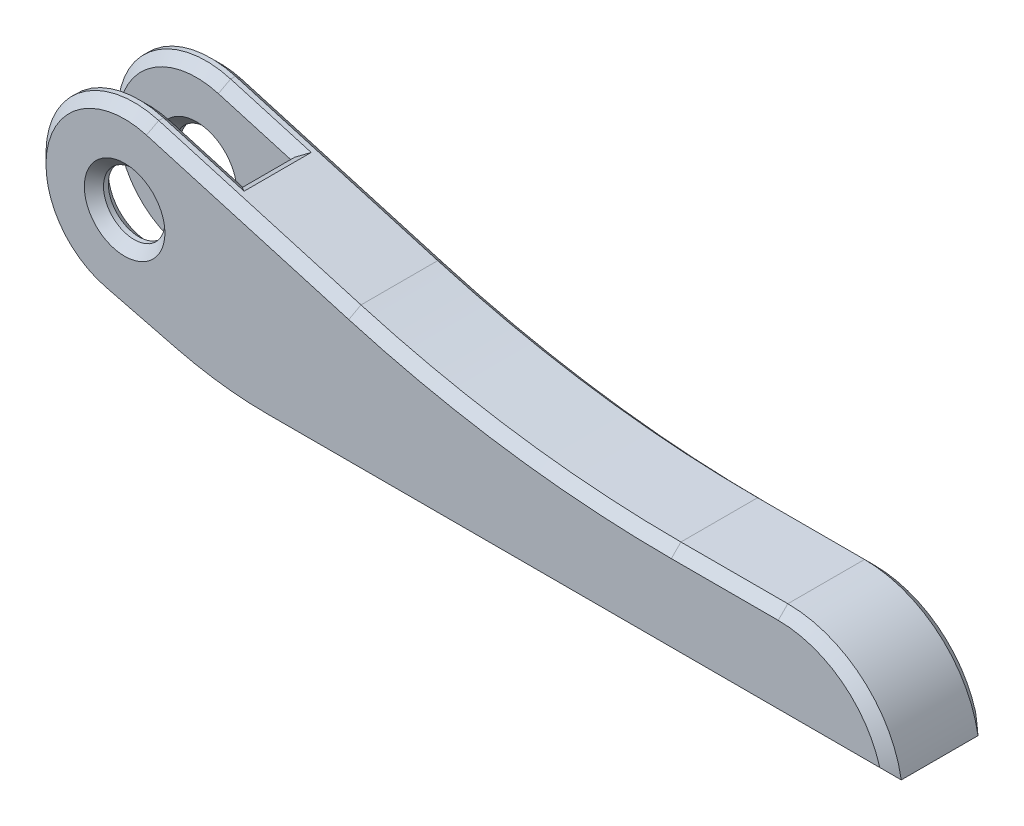
from build123d import *

# Parameters (mm, degrees)
SKETCH1_W           = 44.45
SKETCH1_H           = 6.35
BOSS_EXTRUDE1_DEPTH = 6.35
SKETCH2_R           = 5.842
SKETCH2_R_2         = 2.032
BOSS_EXTRUDE2_DEPTH = 6.35
SKETCH4_W           = 12.192
SKETCH4_H           = 3.175
CUT_EXTRUDE2_DEPTH  = 38.092262778
FILLET1_R           = 76.2
FILLET2_R           = 25.4
FILLET3_R           = 7.62
SKETCH1_3_R         = 2.032
CUT_EXTRUDE1_DEPTH  = 5.08
CHAMFER2_SIZE       = 0.635
CHAMFER2_SIZE_2     = 0.512675012
CHAMFER2_SIZE_3     = 0.731105081


with BuildPart() as part:
    # Sketch1 → Boss-Extrude1 (new body)
    with BuildSketch(Plane(origin=(0, 0, 0), x_dir=(1, 0, 0), z_dir=(0, 1, 0))):
        Rectangle(SKETCH1_W, SKETCH1_H)
    extrude(amount=BOSS_EXTRUDE1_DEPTH)

    # Sketch2 → Boss-Extrude2 (add, through all)
    # profile 1 of 2: a face of its own
    with BuildSketch(Plane.XY.offset(3.175)):
        with BuildLine():
            Line((-3.175, 6.35), (-26.950756689, 13.231666211))
            ThreePointArc((-26.950756689, 13.231666211), (-23.905000352, 11.12999534), (-22.733, 7.62))
            ThreePointArc((-22.733, 7.62), (-24.982746663, 3.012974934), (-29.999237577, 1.954268686))
            Line((-29.999237577, 1.954268686), (-22.225, 0))
            Line((-22.225, 0), (-22.225, 6.35))
            Line((-22.225, 6.35), (-3.175, 6.35))
        make_face()
    # profile 2 of 2: a face of its own
    with BuildSketch(Plane.XY.offset(3.175)):
        with Locations((-28.575, 7.62)):
            Circle(SKETCH2_R)
        with Locations((-28.575, 7.62)):
            Circle(SKETCH2_R_2, mode=Mode.SUBTRACT)
    extrude(amount=-BOSS_EXTRUDE2_DEPTH)

    # Sketch4 → Cut-Extrude2 (cut, through all)
    with BuildSketch(Plane.XZ):
        with Locations((-28.321, 0)):
            Rectangle(SKETCH4_W, SKETCH4_H)
    extrude(amount=-CUT_EXTRUDE2_DEPTH, mode=Mode.SUBTRACT)

    # Fillet1
    fillet1_edges = [part.edges().sort_by_distance(p)[0] for p in [
        (-3.175, 6.35, 0),
    ]]
    fillet(fillet1_edges, radius=FILLET1_R)

    # Fillet2
    # the kernel refuses this fillet: 25.4 mm, written as the material it takes off along each edge
    with BuildSketch(Plane(origin=(-22.225, 0, 6.271484857), x_dir=(-0.9698273389527705, 0.2437928067433249, 0), z_dir=(0, 0, -1))) as fillet2_piece_1:
        with BuildLine():
            CenterArc((FILLET2_R * 0.123763541059, FILLET2_R), FILLET2_R, 255.889496413, 14.110503587)
            Line((-FILLET2_R * 0.120029265684, FILLET2_R * 0.0301726610472), (0, 0))
            Line((0, 0), (FILLET2_R * 0.123763541059, 0))
        make_face()
    extrude(amount=17.305469714, mode=Mode.SUBTRACT)
    with BuildSketch(Plane(origin=(-22.225, 0, 11.033984857), x_dir=(1, 0, 0), z_dir=(0, 0, -1))) as fillet2_piece_2:
        with BuildLine():
            CenterArc((FILLET2_R * 0.123763541059, -FILLET2_R), FILLET2_R, 90, 14.110503587)
            Line((-FILLET2_R * 0.120029265684, -FILLET2_R * 0.0301726610472), (0, 0))
            Line((0, 0), (FILLET2_R * 0.123763541059, 0))
        make_face()
    extrude(amount=17.305469714, mode=Mode.SUBTRACT)

    # Fillet3
    # the kernel refuses this fillet: 7.62 mm, written as the material it takes off along each edge
    with BuildSketch(Plane(origin=(22.225, 6.35, -21.958553311), x_dir=(0, -1, 0), z_dir=(0, 0, 1))) as fillet3_piece_1:
        with BuildLine():
            CenterArc((7.62, -7.513421325), FILLET3_R, 99.594068227, 80.405931773)
            Line((0, -7.513421325), (-0.1524, -7.513421325))
            Line((-0.1524, -7.513421325), (-0.1524, 0))
            Line((-0.1524, 0), (0, 0.1524))
            ThreePointArc((0, 0.1524), (3.175, 0.1524), (6.3246, 0.150268426))
            Line((6.3246, 0.150268426), (6.35, 0))
        make_face()
    extrude(amount=43.917106623, mode=Mode.SUBTRACT)

    # Sketch1<3> → Cut-Extrude1 (cut)
    with BuildSketch(Plane(origin=(0, 0, 0), x_dir=(1, 0, 0), z_dir=(0, 1, 0))):
        with Locations(Location((-15.875, 0, 0), (0, 0, 270))):
            Circle(SKETCH1_3_R)
        with Locations(Location((15.875, 0, 0), (0, 0, 270))):
            Circle(SKETCH1_3_R)
    extrude(amount=CUT_EXTRUDE1_DEPTH, mode=Mode.SUBTRACT)

    # Chamfer2
    # the kernel refuses this chamfer: 0.731105081, 0.635, 0.512675012 mm, written as the material it takes off along each edge
    with BuildSketch(Plane(origin=(-13.554867596, 9.354353764, 3.175), x_dir=(0, 0, -1), z_dir=(-0.9605727852432785, 0.27802863926216387, 0)), Plane(origin=(-13.554867596, 9.354353764, -3.175), x_dir=(-0.27802863926216387, -0.9605727852432785, 0), z_dir=(-0.9605727852432785, 0.27802863926216387, 0))) as chamfer2_piece_1:
        Polygon((CHAMFER2_SIZE, 0), (0, CHAMFER2_SIZE), (0, 0), align=None)
    extrude(amount=13.945730401, mode=Mode.SUBTRACT)
    with BuildSketch(Plane(origin=(-29.999237577, 1.954268686, -3.175), x_dir=(0.2437928067433245, 0.9698273389527705, 0), z_dir=(0.9698273389527705, -0.24379280674332449, 0))) as chamfer2_piece_2:
        Polygon((CHAMFER2_SIZE, 0), (0, CHAMFER2_SIZE), (0, 0), align=None)
    extrude(amount=4.872510847, mode=Mode.SUBTRACT)
    with BuildSketch(Plane(origin=(-28.575, 7.62, -3.175), x_dir=(0.2780286392621638, 0.9605727852432784, 0), z_dir=(0.9605727852432784, -0.2780286392621638, 0))) as chamfer2_piece_3:
        Polygon((5.842 - CHAMFER2_SIZE, 0), (5.842, CHAMFER2_SIZE), (5.842, 0), align=None)
    revolve(axis=Axis((-28.575, 7.62, -3.175), (0, 0, 1)), revolution_arc=182.032079325, mode=Mode.SUBTRACT)
    with BuildSketch(Plane(origin=(-28.575, 7.62, 3.175), x_dir=(1, 0, 0), z_dir=(0, -1, 0))) as chamfer2_piece_4:
        Polygon((2.032 + CHAMFER2_SIZE, 0), (2.032, -CHAMFER2_SIZE), (2.032, 0), align=None)
    revolve(axis=Axis((-28.575, 7.62, 3.175), (0, 0, 1)), mode=Mode.SUBTRACT)
    with BuildSketch(Plane(origin=(-28.575, 7.62, -3.175), x_dir=(1, 0, 0), z_dir=(0, -1, 0))) as chamfer2_piece_5:
        Polygon((2.032 + CHAMFER2_SIZE, 0), (2.032, CHAMFER2_SIZE), (2.032, 0), align=None)
    revolve(axis=Axis((-28.575, 7.62, -3.175), (0, 0, 1)), mode=Mode.SUBTRACT)
    with BuildSketch(Plane(origin=(-28.575, 7.62, 3.175), x_dir=(0.2780286392621638, 0.9605727852432784, 0), z_dir=(0.9605727852432784, -0.2780286392621638, 0))) as chamfer2_piece_6:
        Polygon((5.842 - CHAMFER2_SIZE, 0), (5.842, -CHAMFER2_SIZE), (5.842, 0), align=None)
    revolve(axis=Axis((-28.575, 7.62, 3.175), (0, 0, 1)), revolution_arc=182.032079325, mode=Mode.SUBTRACT)
    with BuildSketch(Plane(origin=(-29.999237577, 1.954268686, 3.175), x_dir=(0.24379280674332446, 0.9698273389527705, 0), z_dir=(0.9698273389527705, -0.24379280674332449, 0))) as chamfer2_piece_7:
        Polygon((CHAMFER2_SIZE, 0), (0, -CHAMFER2_SIZE), (0, 0), align=None)
    extrude(amount=4.872510847, mode=Mode.SUBTRACT)
    with BuildSketch(Plane(origin=(-28.575, 7.62, -1.5875), x_dir=(1, 0, 0), z_dir=(0, -1, 0))) as chamfer2_piece_8:
        Polygon((2.032, -CHAMFER2_SIZE), (2.032 + CHAMFER2_SIZE, 0), (2.032, 0), align=None)
    revolve(axis=Axis((-28.575, 7.62, -1.5875), (0, 0, 1)), mode=Mode.SUBTRACT)
    with BuildSketch(Plane(origin=(-28.575, 7.62, 1.5875), x_dir=(1, 0, 0), z_dir=(0, -1, 0))) as chamfer2_piece_9:
        Polygon((2.032 + CHAMFER2_SIZE, 0), (2.032, CHAMFER2_SIZE), (2.032, 0), align=None)
    revolve(axis=Axis((-28.575, 7.62, 1.5875), (0, 0, 1)), mode=Mode.SUBTRACT)
    with BuildSketch(Plane(origin=(7.630914716, 6.35, -3.175), x_dir=(0, -1, 0), z_dir=(1, 0, 0))) as chamfer2_piece_10:
        Polygon((CHAMFER2_SIZE, 0), (0, -CHAMFER2_SIZE), (0, 0), align=None)
    extrude(amount=7.08066396, mode=Mode.SUBTRACT)
    with BuildSketch(Plane(origin=(14.711578675, 6.35, 3.175), x_dir=(0, 0, -1), z_dir=(-1, 0, 0))) as chamfer2_piece_11:
        Polygon((CHAMFER2_SIZE, 0), (0, CHAMFER2_SIZE), (0, 0), align=None)
    extrude(amount=7.08066396, mode=Mode.SUBTRACT)
    with BuildSketch(Plane(origin=(7.630914716, 82.55, 3.175), x_dir=(0, -1, 0), z_dir=(1, 0, 0))) as chamfer2_piece_12:
        Polygon((76.2, CHAMFER2_SIZE), (76.2 + CHAMFER2_SIZE, 0), (76.2, 0), align=None)
    revolve(axis=Axis((7.630914716, 82.55, 3.175), (0, 0, -1)), revolution_arc=16.142582912, mode=Mode.SUBTRACT)
    with BuildSketch(Plane(origin=(7.630914716, 82.55, -3.175), x_dir=(0, -1, 0), z_dir=(1, 0, 0))) as chamfer2_piece_13:
        Polygon((76.2 + CHAMFER2_SIZE, 0), (76.2, -CHAMFER2_SIZE), (76.2, 0), align=None)
    revolve(axis=Axis((7.630914716, 82.55, -3.175), (0, 0, -1)), revolution_arc=16.142582912, mode=Mode.SUBTRACT)
    with BuildSketch(Plane(origin=(23.858018697, 0, 3.175), x_dir=(0, 0, -1), z_dir=(-1, 0, 0))) as chamfer2_piece_14:
        Polygon((CHAMFER2_SIZE, 0), (0, -CHAMFER2_SIZE), (0, 0), align=None)
    extrude(amount=42.939424754, mode=Mode.SUBTRACT)
    with BuildSketch(Plane(origin=(-19.081406057, 25.4, 3.175), x_dir=(-0.24379280674296488, -0.9698273389528609, 0), z_dir=(-0.9698273389528609, 0.24379280674296488, 0))) as chamfer2_piece_15:
        Polygon((25.4, -CHAMFER2_SIZE), (25.4 - CHAMFER2_SIZE, 0), (25.4, 0), align=None)
    revolve(axis=Axis((-19.081406057, 25.4, 3.175), (0, 0, 1)), revolution_arc=14.110503587, mode=Mode.SUBTRACT)
    with BuildSketch(Plane(origin=(-19.081406057, 0, -3.175), x_dir=(0, 1, 0), z_dir=(1, 0, 0))) as chamfer2_piece_16:
        Polygon((CHAMFER2_SIZE, 0), (0, CHAMFER2_SIZE), (0, 0), align=None)
    extrude(amount=42.939424754, mode=Mode.SUBTRACT)
    with BuildSketch(Plane(origin=(-19.081406057, 25.4, -3.175), x_dir=(-0.24379280674296488, -0.9698273389528609, 0), z_dir=(-0.9698273389528609, 0.24379280674296488, 0))) as chamfer2_piece_17:
        Polygon((25.4 - CHAMFER2_SIZE, 0), (25.4, CHAMFER2_SIZE), (25.4, 0), align=None)
    revolve(axis=Axis((-19.081406057, 25.4, -3.175), (0, 0, 1)), revolution_arc=14.110503587, mode=Mode.SUBTRACT)
    with BuildSketch(Plane(origin=(14.711578675, -1.27, 3.175), x_dir=(0, 1, 0), z_dir=(-1, 0, 0))) as chamfer2_piece_18:
        Polygon((7.62, CHAMFER2_SIZE), (7.62 - CHAMFER2_SIZE, 0), (7.62, 0), align=None)
    revolve(axis=Axis((14.711578675, -1.27, 3.175), (0, 0, -1)), revolution_arc=92.688750294, mode=Mode.SUBTRACT)
    with BuildSketch(Plane(origin=(14.711578675, -1.27, -3.175), x_dir=(0, 1, 0), z_dir=(-1, 0, 0))) as chamfer2_piece_19:
        Polygon((7.62 - CHAMFER2_SIZE, 0), (7.62, -CHAMFER2_SIZE), (7.62, 0), align=None)
    revolve(axis=Axis((14.711578675, -1.27, -3.175), (0, 0, -1)), revolution_arc=92.688750294, mode=Mode.SUBTRACT)
    with BuildSketch(Plane(origin=(-15.875, 0, 0), x_dir=(0, 0, 1), z_dir=(-1, 0, 0))) as chamfer2_piece_20:
        Polygon((2.032 + CHAMFER2_SIZE, 0), (2.032, CHAMFER2_SIZE), (2.032, 0), align=None)
    revolve(axis=Axis((-15.875, 0, 0), (0, 1, 0)), mode=Mode.SUBTRACT)
    with BuildSketch(Plane(origin=(15.875, 0, 0), x_dir=(0, 0, 1), z_dir=(-1, 0, 0))) as chamfer2_piece_21:
        Polygon((2.032 + CHAMFER2_SIZE, 0), (2.032, CHAMFER2_SIZE), (2.032, 0), align=None)
    revolve(axis=Axis((15.875, 0, 0), (0, 1, 0)), mode=Mode.SUBTRACT)
    with BuildSketch(Plane(origin=(-22.225, 11.86384097, 1.5875), x_dir=(0.9605727852432789, -0.278028639262162, 0), z_dir=(0, 0, -1))) as chamfer2_piece_22:
        Polygon((CHAMFER2_SIZE, 0), (CHAMFER2_SIZE_2 * 0.278028639187, CHAMFER2_SIZE_2 * 0.960572784984), (0, 0), align=None)
    extrude(amount=3.175, mode=Mode.SUBTRACT)
    with BuildSketch(Plane(origin=(-22.225, 0.195281848, -1.5875), x_dir=(0.9937643681365105, -0.11150058574842527, 0), z_dir=(0, 0, 1))) as chamfer2_piece_23:
        with BuildLine():
            Line((0.627301622, 0), (-CHAMFER2_SIZE_3 * 0.111500585736, CHAMFER2_SIZE_3 * 0.993764368022))
            Line((-CHAMFER2_SIZE_3 * 0.111500585736, CHAMFER2_SIZE_3 * 0.993764368022), (0, 0))
            ThreePointArc((0, 0), (0.323858306, -0.001934575), (0.627301622, 0))
        make_face()
    extrude(amount=3.175, mode=Mode.SUBTRACT)
    # the kernel refuses this chamfer: 0.731105081, 0.635, 0.512675012 mm, written as the material it takes off along each edge
    with BuildSketch(Plane(origin=(-28.575, 7.62, 1.5875), x_dir=(0.2780286392621638, 0.9605727852432784, 0), z_dir=(0.9605727852432784, -0.2780286392621638, 0))) as chamfer2_2_piece_1:
        Polygon((5.842, CHAMFER2_SIZE), (5.842 - CHAMFER2_SIZE, 0), (5.842, 0), align=None)
    revolve(axis=Axis((-28.575, 7.62, 1.5875), (0, 0, 1)), revolution_arc=182.032079325, mode=Mode.SUBTRACT)
    with BuildSketch(Plane(origin=(-25.273743348, 0.766385591, 1.5875), x_dir=(0, 0, 1), z_dir=(-0.9698273389527705, 0.24379280674332449, 0))) as chamfer2_2_piece_2:
        Polygon((CHAMFER2_SIZE, 0), (0, CHAMFER2_SIZE), (0, 0), align=None)
    extrude(amount=4.872510847, mode=Mode.SUBTRACT)
    with BuildSketch(Plane(origin=(-20.046402963, 11.233266818, 1.5875), x_dir=(0, 0, 1), z_dir=(-0.9605727852432785, 0.2780286392621639, 0))) as chamfer2_2_piece_3_section:
        Polygon((CHAMFER2_SIZE, 0), (0, -CHAMFER2_SIZE), (0, 0), align=None)
    chamfer2_2_piece_3 = extrude(amount=7.187746554, mode=Mode.PRIVATE)
    chamfer2_2_piece_3 = split(chamfer2_2_piece_3, bisect_by=Plane(origin=(-22.225, 11.233266818, 1.5875), z_dir=(-1, 0, 0)), keep=Keep.TOP, mode=Mode.PRIVATE)
    add(chamfer2_2_piece_3, mode=Mode.SUBTRACT)
    with BuildSketch(Plane(origin=(-20.046402963, 11.233266818, 1.5875), x_dir=(0, 0, 1), z_dir=(-0.9605727852432785, 0.2780286392621639, 0))) as chamfer2_2_piece_4_section:
        Polygon((CHAMFER2_SIZE, 0), (0, -CHAMFER2_SIZE), (0, 0), align=None)
    chamfer2_2_piece_4 = extrude(amount=7.187746554, mode=Mode.PRIVATE)
    chamfer2_2_piece_4 = split(chamfer2_2_piece_4, bisect_by=Plane(origin=(-20.603706639, 12.24459646, 1.5875), z_dir=(-0.48263159408242934, 0.8758234664551146, 0)), keep=Keep.TOP, mode=Mode.PRIVATE)
    add(chamfer2_2_piece_4, mode=Mode.SUBTRACT)
    with BuildSketch(Plane(origin=(-26.950756689, 13.231666211, -1.5875), x_dir=(-0.27802863926216387, -0.9605727852432785, 0), z_dir=(0.9605727852432785, -0.2780286392621639, 0))) as chamfer2_2_piece_5_section:
        Polygon((CHAMFER2_SIZE, 0), (0, CHAMFER2_SIZE), (0, 0), align=None)
    chamfer2_2_piece_5 = extrude(amount=7.187746554, mode=Mode.PRIVATE)
    chamfer2_2_piece_5 = split(chamfer2_2_piece_5, bisect_by=Plane(origin=(-25.055083199, 9.791619294, -1.5875), z_dir=(-0.48263159408242934, 0.8758234664551146, 0)), keep=Keep.TOP, mode=Mode.PRIVATE)
    add(chamfer2_2_piece_5, mode=Mode.SUBTRACT)
    with BuildSketch(Plane(origin=(-26.950756689, 13.231666211, -1.5875), x_dir=(-0.27802863926216387, -0.9605727852432785, 0), z_dir=(0.9605727852432785, -0.2780286392621639, 0))) as chamfer2_2_piece_6_section:
        Polygon((CHAMFER2_SIZE, 0), (0, CHAMFER2_SIZE), (0, 0), align=None)
    chamfer2_2_piece_6 = extrude(amount=7.187746554, mode=Mode.PRIVATE)
    chamfer2_2_piece_6 = split(chamfer2_2_piece_6, bisect_by=Plane(origin=(-22.225, 13.231666211, -1.5875), z_dir=(-1, 0, 0)), keep=Keep.TOP, mode=Mode.PRIVATE)
    add(chamfer2_2_piece_6, mode=Mode.SUBTRACT)
    with BuildSketch(Plane(origin=(-28.575, 7.62, -1.5875), x_dir=(-0.24379280674332418, -0.9698273389527706, 0), z_dir=(0.9698273389527706, -0.24379280674332418, 0))) as chamfer2_2_piece_7:
        Polygon((5.842 - CHAMFER2_SIZE, 0), (5.842, CHAMFER2_SIZE), (5.842, 0), align=None)
    revolve(axis=Axis((-28.575, 7.62, -1.5875), (0, 0, -1)), revolution_arc=182.032079325, mode=Mode.SUBTRACT)
    with BuildSketch(Plane(origin=(-29.999237577, 1.954268686, -1.5875), x_dir=(0.24379280674332454, 0.9698273389527706, 1.0490296295670768e-15), z_dir=(0.9698273389527705, -0.24379280674332449, 0))) as chamfer2_2_piece_8:
        Polygon((CHAMFER2_SIZE, 0), (0, -CHAMFER2_SIZE), (0, 0), align=None)
    extrude(amount=4.872510847, mode=Mode.SUBTRACT)
    with BuildSketch(Plane(origin=(-19.081406057, 25.4, 1.5875), x_dir=(-0.24379280674296486, -0.9698273389528609, 0), z_dir=(-0.9698273389528609, 0.24379280674296486, 0))) as chamfer2_2_piece_9_section:
        Polygon((25.4 - CHAMFER2_SIZE, 0), (25.4, CHAMFER2_SIZE), (25.4, 0), align=None)
    chamfer2_2_piece_9 = revolve(axis=Axis((-19.081406057, 25.4, 1.5875), (0, 0, 1)), revolution_arc=12.099888527, mode=Mode.PRIVATE)
    chamfer2_2_piece_9 = split(chamfer2_2_piece_9, bisect_by=Plane(origin=(-32.901208203, 14.645201948, 1.5875), z_dir=(-0.7891843983264014, -0.6141563200343995, 0)), keep=Keep.TOP, mode=Mode.PRIVATE)
    add(chamfer2_2_piece_9, mode=Mode.SUBTRACT)
    with BuildSketch(Plane(origin=(-19.081406057, 25.4, -1.5875), x_dir=(-0.03508465098697838, -0.9993843441164775, 0), z_dir=(0.9993843441164775, -0.03508465098697838, 0))) as chamfer2_2_piece_10_section:
        Polygon((25.4 - CHAMFER2_SIZE, 0), (25.4, CHAMFER2_SIZE), (25.4, 0), align=None)
    chamfer2_2_piece_10 = revolve(axis=Axis((-19.081406057, 25.4, -1.5875), (0, 0, -1)), revolution_arc=12.099888527, mode=Mode.PRIVATE)
    chamfer2_2_piece_10 = split(chamfer2_2_piece_10, bisect_by=Plane(origin=(-32.901208203, 14.645201948, -1.5875), z_dir=(-0.7891843983264014, -0.6141563200343995, 0)), keep=Keep.TOP, mode=Mode.PRIVATE)
    add(chamfer2_2_piece_10, mode=Mode.SUBTRACT)


solid = part.part
